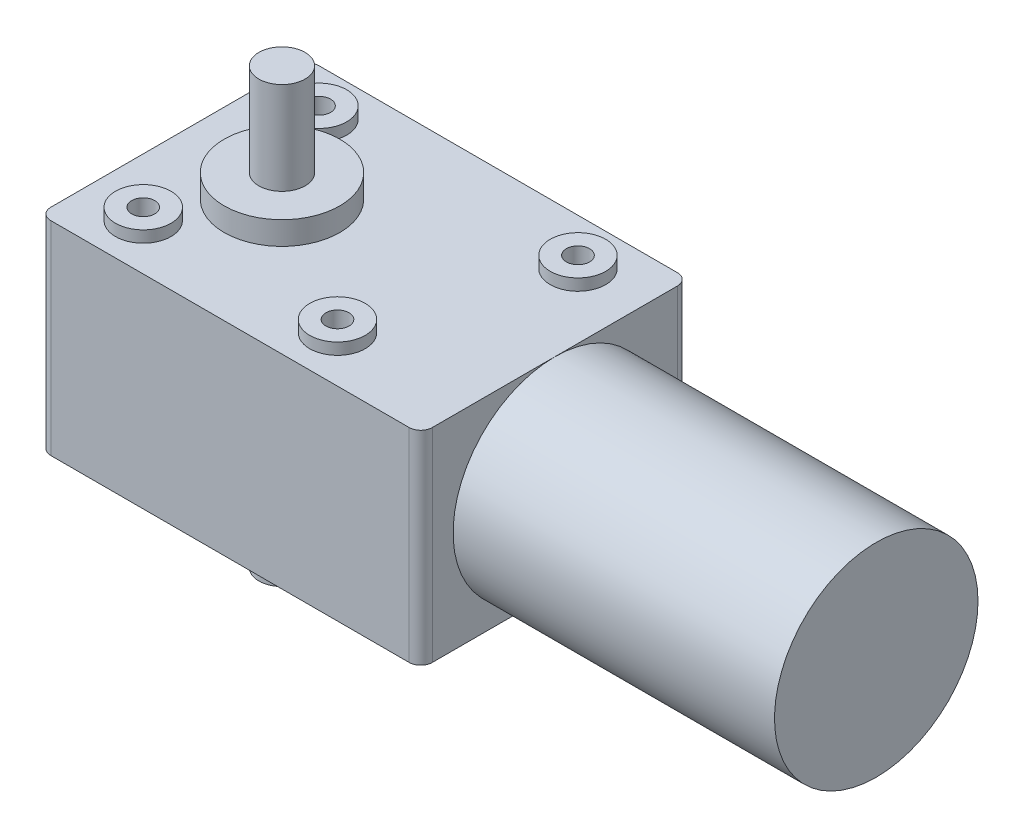
from build123d import *

# Parameters (mm, degrees)
BOSS_EXTRUDE1_DEPTH = 22
SKETCH2_R           = 6
BOSS_EXTRUDE2_DEPTH = 2.5
SKETCH3_R           = 2.5
CUT_EXTRUDE1_DEPTH  = 6
SKETCH6_R           = 12.5
BOSS_EXTRUDE5_DEPTH = 5
SKETCH4_R           = 5
BOSS_EXTRUDE3_DEPTH = 20
SKETCH5_R           = 22
BOSS_EXTRUDE4_DEPTH = 69.5


with BuildPart() as part:
    # Sketch1 → Boss-Extrude1 (new, symmetric)
    with BuildSketch(Plane(origin=(0, 0, 0), x_dir=(1, 0, 0), z_dir=(0, 1, 0))):
        with BuildLine():
            Line((-38.75, -29), (38.75, -29))
            ThreePointArc((38.75, -29), (40.517766953, -28.267766953), (41.25, -26.5))
            Line((41.25, -26.5), (41.25, 26.5))
            ThreePointArc((41.25, 26.5), (40.517766953, 28.267766953), (38.75, 29))
            Line((38.75, 29), (-38.75, 29))
            ThreePointArc((-38.75, 29), (-40.517766953, 28.267766953), (-41.25, 26.5))
            Line((-41.25, 26.5), (-41.25, -26.5))
            ThreePointArc((-41.25, -26.5), (-40.517766953, -28.267766953), (-38.75, -29))
        make_face()
    extrude(amount=BOSS_EXTRUDE1_DEPTH, both=True)

    # Sketch2 → Boss-Extrude2 (add)
    with BuildSketch(Plane(origin=(0, 22, 0), x_dir=(1, 0, 0), z_dir=(0, 1, 0))):
        with Locations((-28.75, 19)):
            Circle(SKETCH2_R)
        with Locations((-28.75, -19)):
            Circle(SKETCH2_R)
        with Locations((13.25, -19)):
            Circle(SKETCH2_R)
        with Locations((27.25, 19)):
            Circle(SKETCH2_R)
    boss_extrude2 = extrude(amount=BOSS_EXTRUDE2_DEPTH)

    # Sketch3 → Cut-Extrude1 (cut)
    with BuildSketch(Plane(origin=(0, 24.5, 0), x_dir=(1, 0, 0), z_dir=(0, 1, 0))):
        with Locations((-28.75, 19)):
            Circle(SKETCH3_R)
        with Locations((27.25, 19)):
            Circle(SKETCH3_R)
        with Locations((13.25, -19)):
            Circle(SKETCH3_R)
        with Locations((-28.75, -19)):
            Circle(SKETCH3_R)
    cut_extrude1 = extrude(amount=-CUT_EXTRUDE1_DEPTH, mode=Mode.SUBTRACT)

    # Sketch6 → Boss-Extrude5 (add)
    with BuildSketch(Plane(origin=(0, 22, 0), x_dir=(1, 0, 0), z_dir=(0, 1, 0))):
        with Locations((-17.75, 0)):
            Circle(SKETCH6_R)
    boss_extrude5 = extrude(amount=BOSS_EXTRUDE5_DEPTH)

    # Sketch4 → Boss-Extrude3 (add)
    with BuildSketch(Plane(origin=(0, 27, 0), x_dir=(1, 0, 0), z_dir=(0, 1, 0))):
        with Locations((-17.75, 0)):
            Circle(SKETCH4_R)
    boss_extrude3 = extrude(amount=BOSS_EXTRUDE3_DEPTH)

    # Sketch5 → Boss-Extrude4 (add)
    with BuildSketch(Plane(origin=(41.25, 0, 0), x_dir=(0, 0, -1), z_dir=(1, 0, 0))):
        Circle(SKETCH5_R)
    extrude(amount=BOSS_EXTRUDE4_DEPTH)

    # Mirror2: Boss-Extrude2, Cut-Extrude1, Boss-Extrude5, Boss-Extrude3 across plane
    add(boss_extrude2.mirror(Plane.ZX))
    add(cut_extrude1.mirror(Plane.ZX), mode=Mode.SUBTRACT)
    add(boss_extrude5.mirror(Plane.ZX))
    add(boss_extrude3.mirror(Plane.ZX))


solid = part.part
